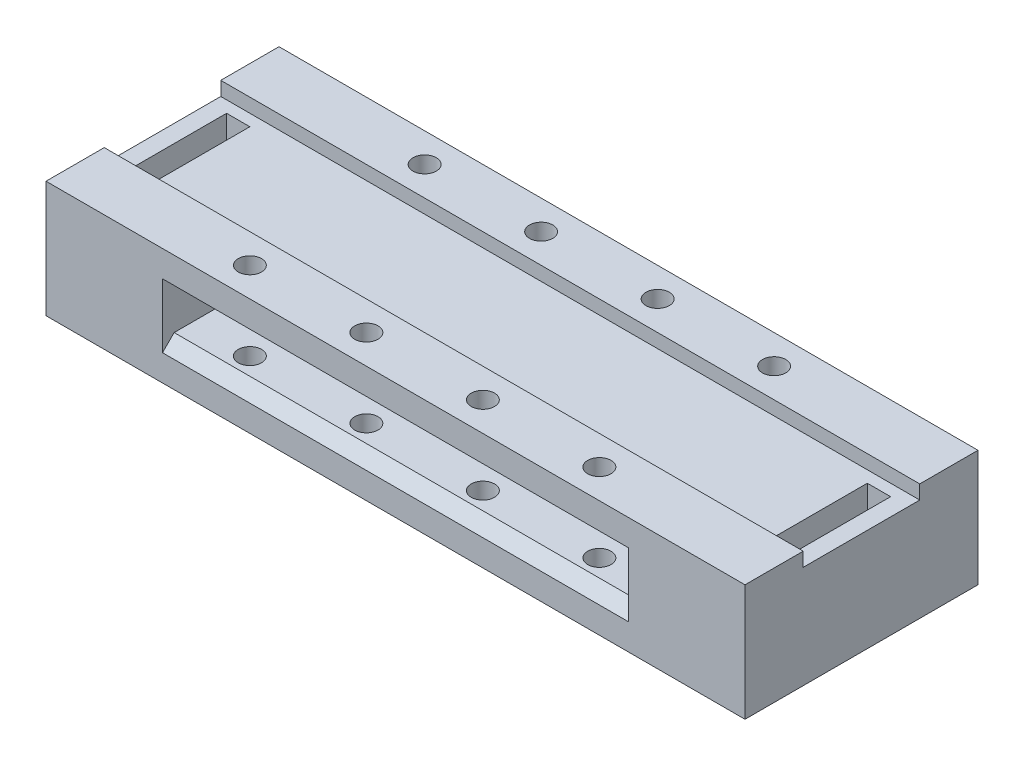
from build123d import *

# Parameters (mm, degrees)
SKETCH1_W                = 60
SKETCH1_H                = 20
BASE_DEPTH               = 10
SKETCH2_R                = 3.81
FSR_MOUNT_DEPTH          = 2
CHAMFER1_SIZE            = 2
CHAMFER1_OF_MIRROR1_SIZE = 2
SKETCH5_W                = 40
SKETCH5_H                = 3.5
CUT_EXTRUDE3_DEPTH       = 20
SKETCH6_W                = 40
SKETCH6_H                = 5
BOSS_EXTRUDE4_DEPTH      = 1
SKETCH8_W                = 40
SKETCH8_H                = 5
CUT_EXTRUDE6_DEPTH       = 1
CHAMFER2_SIZE            = 1
SKETCH9_W                = 2
SKETCH9_H                = 8
CUT_EXTRUDE7_DEPTH       = 10
SKETCH10_W               = 60
SKETCH10_H               = 10
CUT_EXTRUDE8_DEPTH       = 1.2
SKETCH11_R               = 1
CUT_EXTRUDE9_DEPTH       = 34.823069051


with BuildPart() as part:
    # Sketch1 → Base (new body)
    with BuildSketch(Plane(origin=(0, 0, 0), x_dir=(1, 0, 0), z_dir=(0, 1, 0))):
        Rectangle(SKETCH1_W, SKETCH1_H)
    extrude(amount=BASE_DEPTH)

    # Sketch2 → FSR Mount (add)
    with BuildSketch(Plane.XZ):
        with Locations(Location((-10, 0, 0), (0, 0, 270))):
            Circle(SKETCH2_R)
    fsr_mount = extrude(amount=FSR_MOUNT_DEPTH)

    # Chamfer1
    chamfer1_edges = [part.edges().sort_by_distance(p)[0] for p in [
        (-10, 0, 3.81),
    ]]
    chamfer(chamfer1_edges, length=CHAMFER1_SIZE - 0.0001)  # a hair under: the kernel refuses the full size

    # Mirror1: FSR Mount across plane
    add(fsr_mount.mirror(Plane(origin=(0, 0, 0), x_dir=(0, 0, 1), z_dir=(1, 0, 0))))

    # Chamfer1 of Mirror1
    chamfer1_of_mirror1_edges = [part.edges().sort_by_distance(p)[0] for p in [
        (10, 0, 3.81),
    ]]
    chamfer(chamfer1_of_mirror1_edges, length=CHAMFER1_OF_MIRROR1_SIZE - 0.0001)  # a hair under: the kernel refuses the full size

    # Sketch5 → Cut-Extrude3 (cut)
    with BuildSketch(Plane(origin=(0, 0, -10), x_dir=(-1, 0, 0), z_dir=(0, 0, -1))):
        with Locations((0, 5)):
            Rectangle(SKETCH5_W, SKETCH5_H)
    extrude(amount=-CUT_EXTRUDE3_DEPTH, mode=Mode.SUBTRACT)

    # Sketch6 → Boss-Extrude4 (add)
    with BuildSketch(Plane(origin=(0, 3.25, 0), x_dir=(1, 0, 0), z_dir=(0, 1, 0))):
        Rectangle(SKETCH6_W, SKETCH6_H)
    extrude(amount=BOSS_EXTRUDE4_DEPTH)

    # Sketch8 → Cut-Extrude6 (cut)
    with BuildSketch(Plane.XZ.offset(-6.75)):
        Rectangle(SKETCH8_W, SKETCH8_H)
    extrude(amount=-CUT_EXTRUDE6_DEPTH, mode=Mode.SUBTRACT)

    # Chamfer2
    chamfer2_edges = [part.edges().sort_by_distance(p)[0] for p in [
        (0, 6.75, -2.5),
        (0, 6.75, 10),
        (0, 3.25, -2.5),
        (0, 3.25, 2.5),
        (0, 3.25, -10),
        (0, 6.75, -10),
        (0, 3.25, 10),
        (0, 6.75, 2.5),
    ]]
    chamfer(chamfer2_edges, length=CHAMFER2_SIZE - 0.0001)  # a hair under: the kernel refuses the full size

    # Sketch9 → Cut-Extrude7 (cut)
    with BuildSketch(Plane.XZ):
        with Locations((-27.5, 0)):
            Rectangle(SKETCH9_W, SKETCH9_H)
    cut_extrude7 = extrude(amount=-CUT_EXTRUDE7_DEPTH, mode=Mode.SUBTRACT)

    # Mirror2: Cut-Extrude7 across plane
    add(cut_extrude7.mirror(Plane(origin=(0, 0, 0), x_dir=(0, 0, 1), z_dir=(1, 0, 0))), mode=Mode.SUBTRACT)

    # Sketch10 → Cut-Extrude8 (cut)
    with BuildSketch(Plane(origin=(0, 10, 0), x_dir=(1, 0, 0), z_dir=(0, 1, 0))):
        Rectangle(SKETCH10_W, SKETCH10_H)
    extrude(amount=-CUT_EXTRUDE8_DEPTH, mode=Mode.SUBTRACT)

    # Sketch11 → Cut-Extrude9 (cut, through all)
    with BuildSketch(Plane(origin=(0, 10, 0), x_dir=(1, 0, 0), z_dir=(0, 1, 0))):
        with Locations(Location((-15, -7.5, 0), (0, 0, 270))):
            Circle(SKETCH11_R)
        with Locations(Location((-5, -7.5, 0), (0, 0, 270))):
            Circle(SKETCH11_R)
        with Locations(Location((5, -7.5, 0), (0, 0, 270))):
            Circle(SKETCH11_R)
        with Locations(Location((15, -7.5, 0), (0, 0, 270))):
            Circle(SKETCH11_R)
    cut_extrude9 = extrude(amount=-CUT_EXTRUDE9_DEPTH, mode=Mode.SUBTRACT)

    # Mirror5: Cut-Extrude9 across plane
    add(cut_extrude9.mirror(Plane.XY), mode=Mode.SUBTRACT)


solid = part.part
